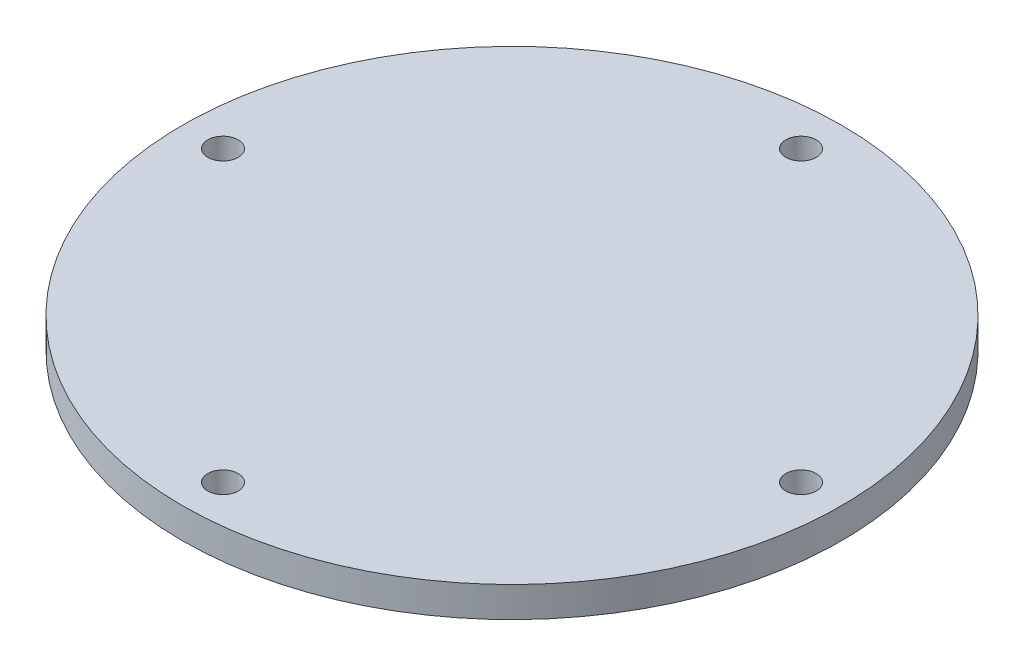
from build123d import *

# Parameters (mm, degrees)
SKETCH1_R           = 32.5
SKETCH1_R_2         = 1.5
BOSS_EXTRUDE1_DEPTH = 3


with BuildPart() as part:
    # Sketch1 → Boss-Extrude1 (new body)
    with BuildSketch(Plane(origin=(0, 0, 0), x_dir=(1, 0, 0), z_dir=(0, 1, 0))):
        Circle(SKETCH1_R)
        with Locations((-28.5, 0)):
            Circle(SKETCH1_R_2, mode=Mode.SUBTRACT)
        with Locations((0, 28.5)):
            Circle(SKETCH1_R_2, mode=Mode.SUBTRACT)
        with Locations((28.5, 0)):
            Circle(SKETCH1_R_2, mode=Mode.SUBTRACT)
        with Locations((0, -28.5)):
            Circle(SKETCH1_R_2, mode=Mode.SUBTRACT)
    extrude(amount=BOSS_EXTRUDE1_DEPTH)


solid = part.part
